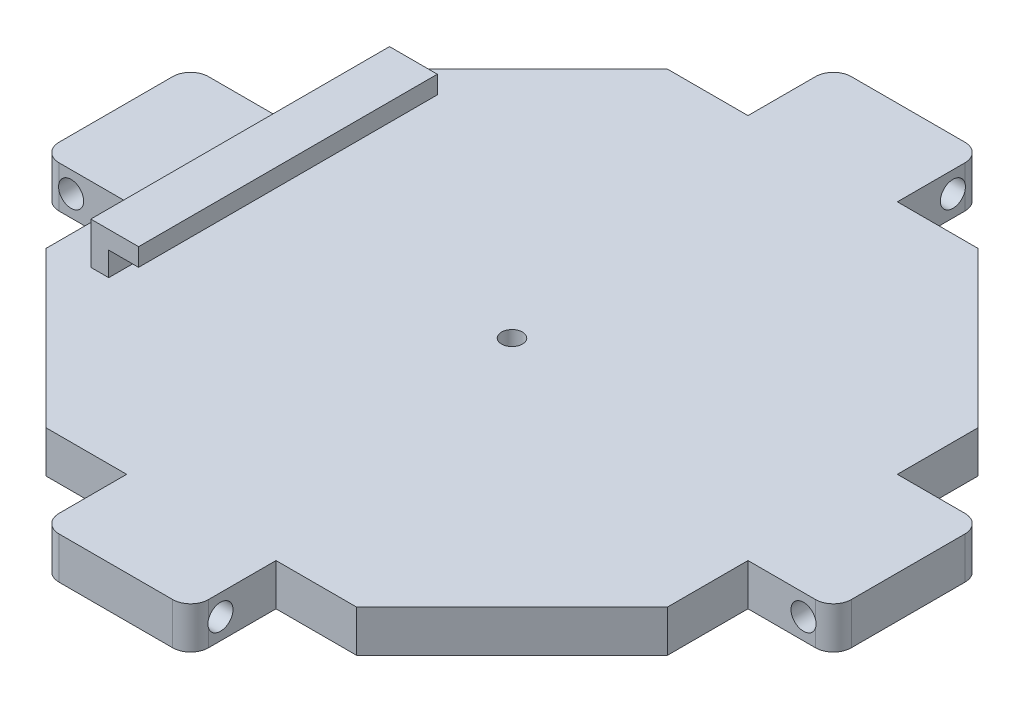
from build123d import *

# Parameters (mm, degrees)
SKETCH_1_W          = 14.3
SKETCH_1_H          = 25
SKETCH_1_W_2        = 25
SKETCH_1_H_2        = 14.3
EXTRUDE_1_DEPTH     = 7
FILLET_1_R          = 3
FILLET_3_R          = 23
EXTRUDE_START       = -7
EXTRUDE_2_DEPTH     = 7
SKETCH_7_R          = 1.75
CUT_EXTRUDE_5_DEPTH = 95.023294986
SKETCH_9_W          = 3
SKETCH_9_H          = 50
EXTRUDE_3_DEPTH     = 7
SKETCH_10_W         = 50
SKETCH_10_H         = 3
EXTRUDE_4_DEPTH     = 5
SKETCH_11_R         = 2.1
CUT_EXTRUDE_6_DEPTH = 104.928485027
SKETCH_12_R         = 2.1
CUT_EXTRUDE_7_DEPTH = 104.928485103


with BuildPart() as part:
    # 스케치1 → 보스-돌출1 (new body)
    with BuildSketch(Plane(origin=(0, 0, 0), x_dir=(1, 0, 0), z_dir=(0, 1, 0))):
        Polygon((-26, 52), (-39, 39), (-26, 39), (26, 39), (39, 39), (26, 52), (12.5, 52), (-12.5, 52), align=None)
        Polygon((-26, 39), (-39, 39), (-39, 26), align=None)
        Polygon((-39, 26), (-39, 39), (-52, 26), (-52, 12.5), (-52, -12.5), (-52, -26), (-39, -39), (-39, -26), align=None)
        with Locations((-59.15, 0)):
            Rectangle(SKETCH_1_W, SKETCH_1_H)
        with Locations((0, 59.15)):
            Rectangle(SKETCH_1_W_2, SKETCH_1_H_2)
        Polygon((39, 39), (26, 39), (39, 26), align=None)
        Polygon((52, 26), (39, 39), (39, 26), (39, -26), (39, -39), (52, -26), (52, -12.5), (52, 12.5), align=None)
        with Locations((59.15, 0)):
            Rectangle(SKETCH_1_W, SKETCH_1_H)
        Polygon((39, -39), (39, -26), (26, -39), align=None)
        Polygon((-26, -39), (-39, -39), (-26, -52), (-12.5, -52), (12.5, -52), (26, -52), (39, -39), (26, -39), align=None)
        Polygon((-26, -39), (-39, -26), (-39, -39), align=None)
        with Locations((0, -59.15)):
            Rectangle(SKETCH_1_W_2, SKETCH_1_H_2)
    extrude(amount=EXTRUDE_1_DEPTH)

    # 필렛1
    fillet_1_edges = [part.edges().sort_by_distance(p)[0] for p in [
        (12.5, 3.5, 66.3),
        (-12.5, 3.5, 66.3),
        (-66.3, 3.5, 12.5),
        (-66.3, 3.5, -12.5),
        (-12.5, 3.5, -66.3),
        (12.5, 3.5, -66.3),
        (66.3, 3.5, -12.5),
        (66.3, 3.5, 12.5),
    ]]
    fillet(fillet_1_edges, radius=FILLET_1_R)

    # 필렛3
    # the kernel refuses this fillet: 23 mm, written as the material it adds along each edge
    with BuildSketch(Plane(origin=(-39, 0, 26), x_dir=(0, 0, -1), z_dir=(0, 1, 0))) as fillet_3_piece_1:
        with BuildLine():
            CenterArc((FILLET_3_R * 0.414213562373, -FILLET_3_R), FILLET_3_R, 90, 45)
            Line((-FILLET_3_R * 0.292893218813, -FILLET_3_R * 0.292893218813), (0, 0))
            Line((0, 0), (FILLET_3_R * 0.414213562373, 0))
        make_face()
    extrude(amount=7)
    with BuildSketch(Plane(origin=(-26, 0, 39), x_dir=(1, 0, 0), z_dir=(0, 1, 0)), Plane(origin=(26, 0, 39), x_dir=(0.7071067811865479, 0, -0.7071067811865471), z_dir=(0, 1, 0)), Plane(origin=(39, 0, 26), x_dir=(0, 0, -1), z_dir=(0, 1, 0)), Plane(origin=(39, 0, -26), x_dir=(-0.7071067811865476, 0, -0.7071067811865476), z_dir=(0, 1, 0)), Plane(origin=(26, 0, -39), x_dir=(-1, 0, 0), z_dir=(0, 1, 0)), Plane(origin=(-26, 0, -39), x_dir=(-0.7071067811865471, 0, 0.7071067811865479), z_dir=(0, 1, 0)), Plane(origin=(-39, 0, -26), x_dir=(0, 0, 1), z_dir=(0, 1, 0))) as fillet_3_piece_2:
        with BuildLine():
            CenterArc((FILLET_3_R * 0.414213562373, FILLET_3_R), FILLET_3_R, 225, 45)
            Line((-FILLET_3_R * 0.292893218813, FILLET_3_R * 0.292893218813), (0, 0))
            Line((0, 0), (FILLET_3_R * 0.414213562373, 0))
        make_face()
    extrude(amount=7)

    # 스케치6 → 보스-돌출2 (add)
    with BuildSketch(Plane(origin=(0, 7, 0), x_dir=(1, 0, 0), z_dir=(0, 1, 0)).offset(EXTRUDE_START)):
        with BuildLine():
            Line((16.473088065, 39), (-16.473088065, 39))
            ThreePointArc((-16.473088065, 39), (-25.120040329, 37.312677367), (-32.4982797, 32.4982797))
            ThreePointArc((-32.4982797, 32.4982797), (-37.312677367, 25.120040329), (-39, 16.473088065))
            Line((-39, 16.473088065), (-39, -16.473088065))
            ThreePointArc((-39, -16.473088065), (-37.312677367, -25.120040329), (-32.4982797, -32.4982797))
            ThreePointArc((-32.4982797, -32.4982797), (-25.120040329, -37.312677367), (-16.473088065, -39))
            Line((-16.473088065, -39), (16.473088065, -39))
            ThreePointArc((16.473088065, -39), (25.120040329, -37.312677367), (32.4982797, -32.4982797))
            ThreePointArc((32.4982797, -32.4982797), (37.312677367, -25.120040329), (39, -16.473088065))
            Line((39, -16.473088065), (39, 16.473088065))
            ThreePointArc((39, 16.473088065), (37.312677367, 25.120040329), (32.4982797, 32.4982797))
            ThreePointArc((32.4982797, 32.4982797), (25.120040329, 37.312677367), (16.473088065, 39))
        make_face()
    extrude(amount=EXTRUDE_2_DEPTH)

    # 스케치7 → 컷-돌출5 (cut, through all)
    with BuildSketch(Plane(origin=(0, 7, 0), x_dir=(1, 0, 0), z_dir=(0, 1, 0))):
        with Locations(Location((0, 0, 0), (0, 0, 270))):
            Circle(SKETCH_7_R)
    extrude(amount=-CUT_EXTRUDE_5_DEPTH, mode=Mode.SUBTRACT)

    # 스케치9 → 보스-돌출3 (add)
    with BuildSketch(Plane(origin=(0, 7, 0), x_dir=(1, 0, 0), z_dir=(0, 1, 0))):
        with Locations((-44, 0)):
            Rectangle(SKETCH_9_W, SKETCH_9_H)
    extrude(amount=EXTRUDE_3_DEPTH)

    # 스케치10 → 보스-돌출4 (add)
    with BuildSketch(Plane(origin=(-42.5, 0, 0), x_dir=(0, 0, -1), z_dir=(1, 0, 0))):
        with Locations((0, 12.5)):
            Rectangle(SKETCH_10_W, SKETCH_10_H)
    extrude(amount=EXTRUDE_4_DEPTH)

    # 스케치11 → 컷-돌출6 (cut, through all)
    with BuildSketch(Plane.XY.offset(12.5)):
        with Locations(Location((-61.3, 3.5, 0), (0, 0, 197.752790162))):
            Circle(SKETCH_11_R)
        with Locations(Location((61.3, 3.5, 0), (0, 0, 17.752790162))):
            Circle(SKETCH_11_R)
    extrude(amount=-CUT_EXTRUDE_6_DEPTH, mode=Mode.SUBTRACT)

    # 스케치12 → 컷-돌출7 (cut, through all)
    with BuildSketch(Plane.ZY.offset(12.5)):
        with Locations(Location((-61.3, 3.5, 0), (0, 0, 162.247209838))):
            Circle(SKETCH_12_R)
        with Locations(Location((61.3, 3.5, 0), (0, 0, 17.752790162))):
            Circle(SKETCH_12_R)
    extrude(amount=-CUT_EXTRUDE_7_DEPTH, mode=Mode.SUBTRACT)


solid = part.part
